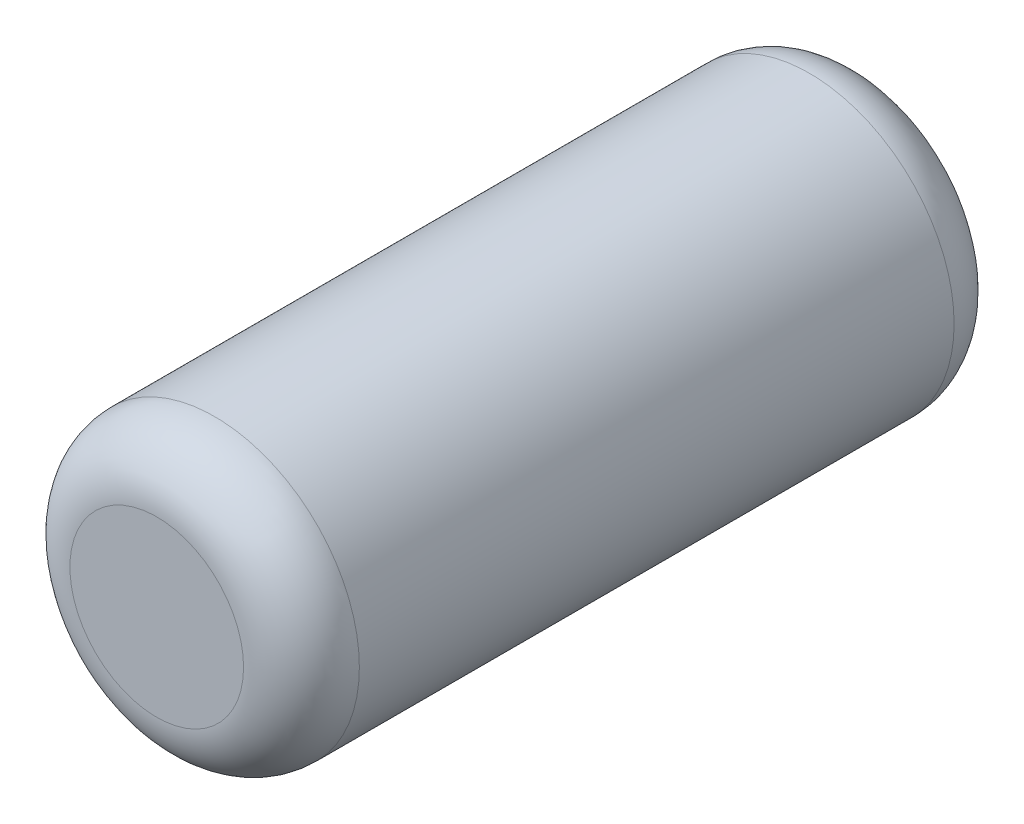
from build123d import *

# Parameters (mm, degrees)
SKETCH1_R           = 34.925
BOSS_EXTRUDE1_DEPTH = 171.45
FILLET1_R           = 13.97


with BuildPart() as part:
    # Sketch1 → Boss-Extrude1 (new body)
    with BuildSketch(Plane.XY):
        Circle(SKETCH1_R)
    extrude(amount=BOSS_EXTRUDE1_DEPTH)

    # Fillet1
    fillet1_edges = [part.edges().sort_by_distance(p)[0] for p in [
        (-34.925, 0, 171.45),
        (-34.925, 0, 0),
    ]]
    fillet(fillet1_edges, radius=FILLET1_R)


solid = part.part
